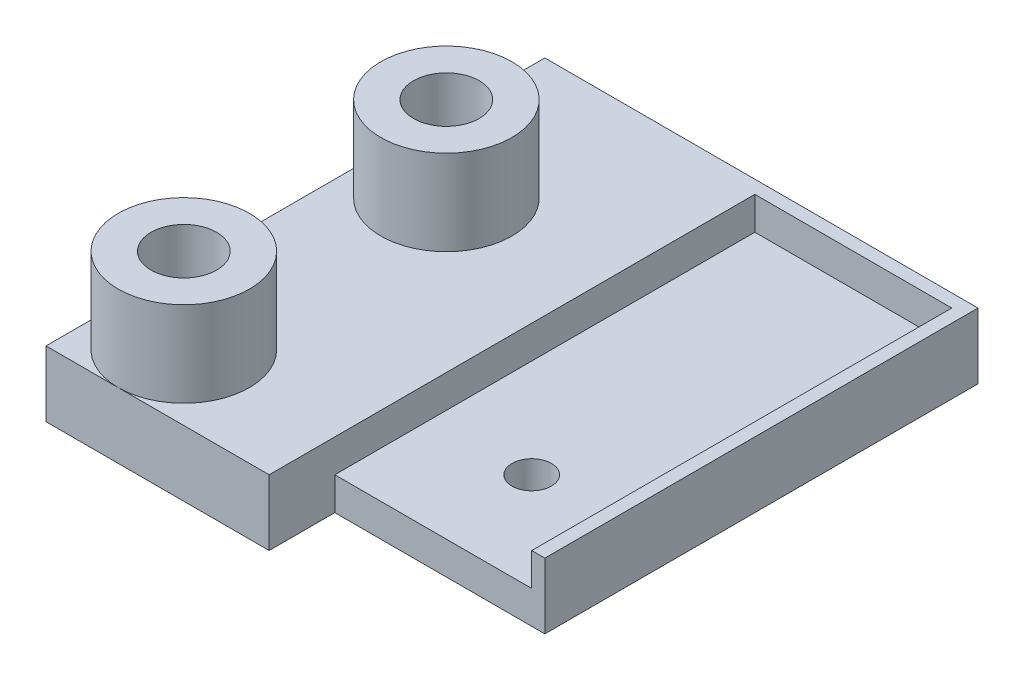
from build123d import *

# Parameters (mm, degrees)
SKETCH1_W                = 33
SKETCH1_H                = 33
BOSS_EXTRUDE1_DEPTH      = 5
SKETCH2_W                = 15
SKETCH2_H                = 32
CUT_EXTRUDE1_DEPTH       = 2.5
SKETCH4_W                = 17
SKETCH4_H                = 5
BOSS_EXTRUDE3_DEPTH      = 5
SKETCH3_R                = 5
SKETCH3_R_2              = 2.5
BOSS_EXTRUDE4_DEPTH      = 6.5
CUT_EXTRUDE4_START       = -5
CUT_EXTRUDE4_OUTLINE_R   = 2.5
CUT_EXTRUDE4_OUTLINE_R_2 = 1.5
CUT_EXTRUDE4_DEPTH       = 5


# Read off the part's stored shape, not the designer's step: Cut-Extrude4
with BuildPart() as part:
    # Sketch1 → Boss-Extrude1 (new body)
    with BuildSketch(Plane(origin=(0, 0, 0), x_dir=(1, 0, 0), z_dir=(0, 1, 0))):
        with Locations((-16.5, 16.5)):
            Rectangle(SKETCH1_W, SKETCH1_H)
    extrude(amount=BOSS_EXTRUDE1_DEPTH)

    # Sketch2 → Cut-Extrude1 (cut)
    with BuildSketch(Plane(origin=(0, 5, 0), x_dir=(1, 0, 0), z_dir=(0, 1, 0))):
        with Locations((-8.5, 16)):
            Rectangle(SKETCH2_W, SKETCH2_H)
    extrude(amount=-CUT_EXTRUDE1_DEPTH, mode=Mode.SUBTRACT)

    # Sketch4 → Boss-Extrude3 (add)
    with BuildSketch(Plane(origin=(0, 5, 0), x_dir=(1, 0, 0), z_dir=(0, 1, 0))):
        with Locations((-24.5, -2.5)):
            Rectangle(SKETCH4_W, SKETCH4_H)
    extrude(amount=-BOSS_EXTRUDE3_DEPTH)

    # Sketch3 → Boss-Extrude4 (add)
    # profile 1 of 2: a face of its own
    with BuildSketch(Plane(origin=(0, 5, 0), x_dir=(1, 0, 0), z_dir=(0, 1, 0))):
        with Locations(Location((-27.5, 20, 0), (0, 0, 90))):
            Circle(SKETCH3_R)
        with Locations(Location((-27.5, 20, 0), (0, 0, 90))):
            Circle(SKETCH3_R_2, mode=Mode.SUBTRACT)
    # profile 2 of 2: a face of its own
    with BuildSketch(Plane(origin=(0, 5, 0), x_dir=(1, 0, 0), z_dir=(0, 1, 0))):
        with Locations(Location((-27.5, 0, 0), (0, 0, 270))):
            Circle(SKETCH3_R)
        with Locations(Location((-27.5, 0, 0), (0, 0, 90))):
            Circle(SKETCH3_R_2, mode=Mode.SUBTRACT)
    extrude(amount=BOSS_EXTRUDE4_DEPTH)

    # Cut-Extrude4 outline → Cut-Extrude4 (cut)
    with BuildSketch(Plane(origin=(0, 5, 0), x_dir=(1, 0, 0), z_dir=(0, 1, 0)).offset(CUT_EXTRUDE4_START)):
        with Locations((-27.5, 20)):
            Circle(CUT_EXTRUDE4_OUTLINE_R)
        with Locations((-27.5, 0)):
            Circle(CUT_EXTRUDE4_OUTLINE_R)
        with Locations((-8.5, 7.5)):
            Circle(CUT_EXTRUDE4_OUTLINE_R_2)
    extrude(amount=CUT_EXTRUDE4_DEPTH, mode=Mode.SUBTRACT)


solid = part.part
